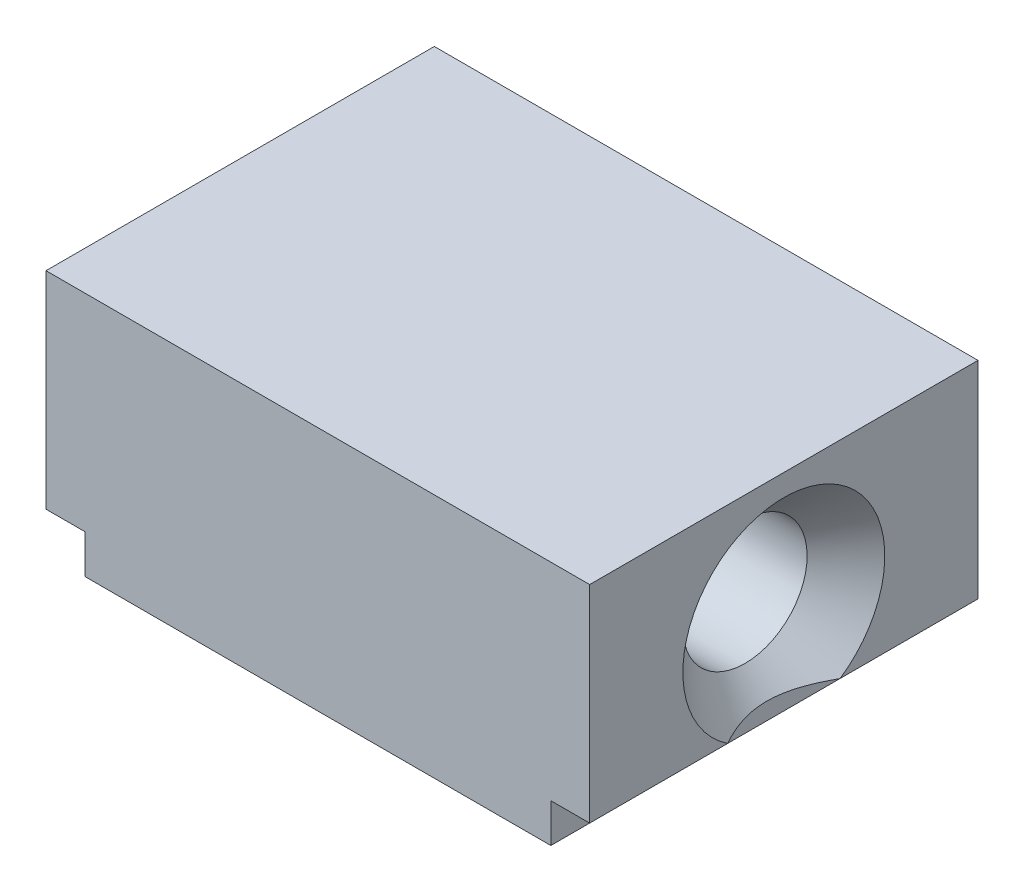
from build123d import *

# Parameters (mm, degrees)
SKETCH1_W           = 6
SKETCH1_H           = 5
BOSS_EXTRUDE1_DEPTH = 0.5
SKETCH2_W           = 7
SKETCH2_H           = 5
BOSS_EXTRUDE2_DEPTH = 2.66
SKETCH3_R           = 0.8
CUT_EXTRUDE1_DEPTH  = 9.076855824
CHAMFER1_SIZE       = 0.5


with BuildPart() as part:
    # Sketch1 → Boss-Extrude1 (new body)
    with BuildSketch(Plane(origin=(0, 0, 0), x_dir=(1, 0, 0), z_dir=(0, 1, 0))):
        Rectangle(SKETCH1_W, SKETCH1_H)
    extrude(amount=BOSS_EXTRUDE1_DEPTH)

    # Sketch2 → Boss-Extrude2 (add)
    with BuildSketch(Plane(origin=(0, 0.5, 0), x_dir=(1, 0, 0), z_dir=(0, 1, 0))):
        Rectangle(SKETCH2_W, SKETCH2_H)
    extrude(amount=BOSS_EXTRUDE2_DEPTH)

    # Sketch3 → Cut-Extrude1 (cut, through all)
    with BuildSketch(Plane.ZY.offset(3.5)):
        with Locations((0, 1.58)):
            Circle(SKETCH3_R)
    extrude(amount=-CUT_EXTRUDE1_DEPTH, mode=Mode.SUBTRACT)

    # Chamfer1
    # the kernel refuses this chamfer: 0.5 mm, written as the material it takes off along each edge
    with BuildSketch(Plane(origin=(3.5, 1.58, 0), x_dir=(0, 0, 1), z_dir=(0, -1, 0))) as chamfer1_piece_1:
        Polygon((0.8 + CHAMFER1_SIZE, 0), (0.8, CHAMFER1_SIZE), (0.8, 0), align=None)
    revolve(axis=Axis((3.5, 1.58, 0), (-1, 0, 0)), mode=Mode.SUBTRACT)
    with BuildSketch(Plane(origin=(-3.5, 1.58, 0), x_dir=(0, 0, 1), z_dir=(0, -1, 0))) as chamfer1_piece_2:
        Polygon((0.8 + CHAMFER1_SIZE, 0), (0.8, -CHAMFER1_SIZE), (0.8, 0), align=None)
    revolve(axis=Axis((-3.5, 1.58, 0), (-1, 0, 0)), mode=Mode.SUBTRACT)


solid = part.part
